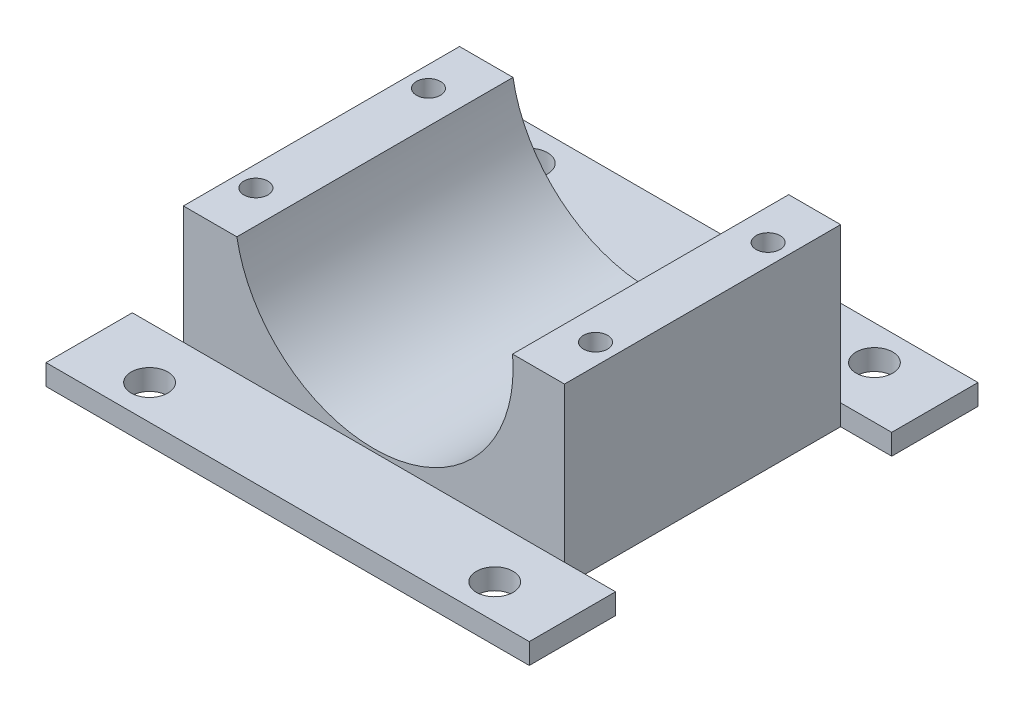
from build123d import *

# Parameters (mm, degrees)
SKETCH1_W                       = 10.823103443
SKETCH1_H                       = 51.052518719
BOSS_EXTRUDE1_DEPTH             = 50.8
SKETCH2_W                       = 177.8
SKETCH2_H                       = 31.75
BOSS_EXTRUDE2_DEPTH             = 7.62
F_1_2_START                     = -59.944
F_1_2_CLEARANCE_HOLE1_OUTLINE_R = 6.74624
F_1_2_CLEARANCE_HOLE1_DEPTH     = 7.62
SKETCH8_R                       = 4.4323
CUT_EXTRUDE2_DEPTH              = 138.353334223
SKETCH9_R                       = 4.4323
CUT_EXTRUDE3_DEPTH              = 132.62094122


# Read off the part's stored shape, not the designer's step: 1/2 Clearance Hole1
with BuildPart() as part:
    # Sketch1 → Boss-Extrude1 (new, symmetric)
    with BuildSketch(Plane.XY):
        with Locations((-64.692448278, -34.41774064)):
            Rectangle(SKETCH1_W, SKETCH1_H)
        with BuildLine():
            ThreePointArc((-2e-09, -59.944), (-39.117081832, -45.421768404), (-59.280896557, -8.891481281))
            Line((-59.280896557, -8.891481281), (-59.280896557, -59.944))
            Line((-59.280896557, -59.944), (-2e-09, -59.944))
        make_face()
        with BuildLine():
            Line((-50.42609614, -8.891481281), (-59.280896557, -8.891481281))
            ThreePointArc((-59.280896557, -8.891481281), (-39.117081832, -45.421768404), (-2e-09, -59.944))
            ThreePointArc((-2e-09, -59.944), (42.386808891, -42.386808892), (59.944, 0))
            ThreePointArc((59.944, 0), (59.902397652, 2.232911009), (59.777648353, 4.462722648))
            Line((59.777648353, 4.462722648), (51.009153275, 4.462722648))
            ThreePointArc((51.009153275, 4.462722648), (51.155265092, 2.233487109), (51.203999954, 0))
            ThreePointArc((51.203999954, 0), (4.462722648, -51.009153275), (-50.42609614, -8.891481281))
        make_face()
        with BuildLine():
            ThreePointArc((59.944, 0), (42.386808891, -42.386808892), (-2e-09, -59.944))
            Line((-2e-09, -59.944), (59.944, -59.944))
            Line((59.944, -59.944), (59.944, 0))
        make_face()
        with BuildLine():
            Line((70.104, 4.462722648), (59.777648353, 4.462722648))
            ThreePointArc((59.777648353, 4.462722648), (59.902397652, 2.232911009), (59.944, 0))
            Line((59.944, 0), (59.944, -59.944))
            Line((59.944, -59.944), (70.104, -59.944))
            Line((70.104, -59.944), (70.104, 4.462722648))
        make_face()
    extrude(amount=BOSS_EXTRUDE1_DEPTH, both=True)

    # Sketch2 → Boss-Extrude2 (add)
    with BuildSketch(Plane.XZ.offset(59.944)):
        with Locations((0, 66.675)):
            Rectangle(SKETCH2_W, SKETCH2_H)
    boss_extrude2 = extrude(amount=-BOSS_EXTRUDE2_DEPTH)

    # 1/2 Clearance Hole1 outline → 1/2 Clearance Hole1 (cut)
    with BuildSketch(Plane(origin=(0, 0, 0), x_dir=(1, 0, 0), z_dir=(0, 1, 0)).offset(F_1_2_START)):
        with Locations((63.5, -69.85)):
            Circle(F_1_2_CLEARANCE_HOLE1_OUTLINE_R)
        with Locations((-63.5, -69.85)):
            Circle(F_1_2_CLEARANCE_HOLE1_OUTLINE_R)
    f_1_2_clearance_hole1 = extrude(amount=F_1_2_CLEARANCE_HOLE1_DEPTH, mode=Mode.SUBTRACT)

    # Mirror1: Boss-Extrude2, 1/2 Clearance Hole1 across plane
    add(boss_extrude2.mirror(Plane.XY))
    add(f_1_2_clearance_hole1.mirror(Plane.XY), mode=Mode.SUBTRACT)

    # Sketch8 → Cut-Extrude2 (cut, through all)
    with BuildSketch(Plane(origin=(0, 4.462722648, 0), x_dir=(1, 0, 0), z_dir=(0, 1, 0))):
        with Locations(Location((62.484, 31.75, 0), (0, 0, 180))):
            Circle(SKETCH8_R)
        with Locations(Location((62.484, -31.75, 0), (0, 0, 180))):
            Circle(SKETCH8_R)
    extrude(amount=-CUT_EXTRUDE2_DEPTH, mode=Mode.SUBTRACT)

    # Sketch9 → Cut-Extrude3 (cut, through all)
    with BuildSketch(Plane(origin=(0, -8.891481281, 0), x_dir=(1, 0, 0), z_dir=(0, 1, 0))):
        with Locations(Location((-62.484, 31.75, 0), (0, 0, 270))):
            Circle(SKETCH9_R)
        with Locations(Location((-62.484, -31.75, 0), (0, 0, 270))):
            Circle(SKETCH9_R)
    extrude(amount=-CUT_EXTRUDE3_DEPTH, mode=Mode.SUBTRACT)


solid = part.part
